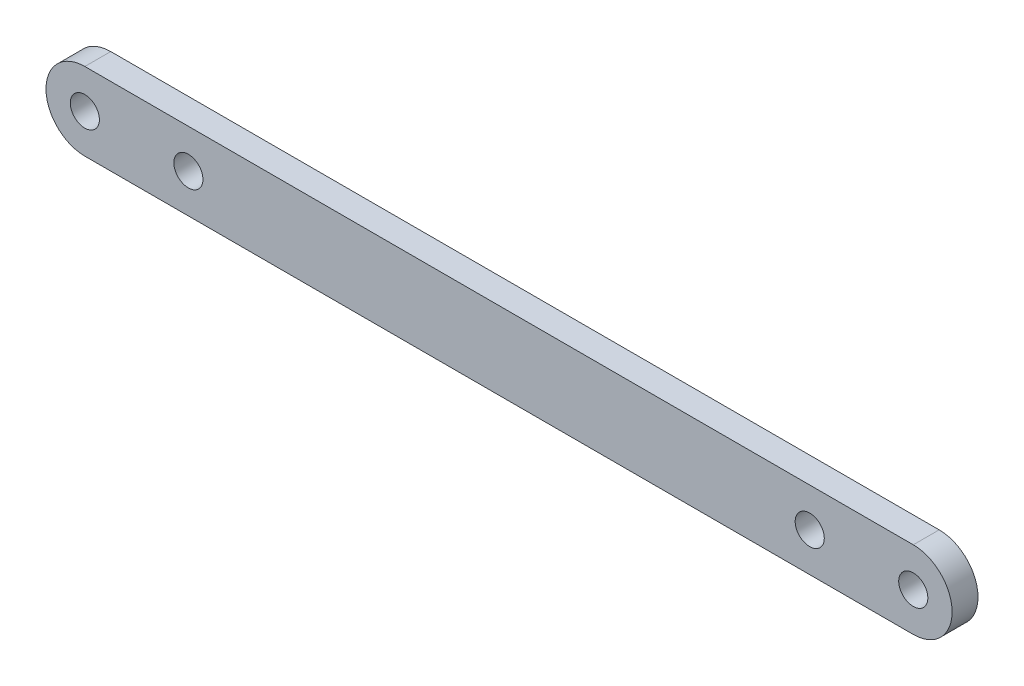
from build123d import *

# Parameters (mm, degrees)
BOSS_EXTRUDE1_DEPTH             = 3.175
F_9_64_0_14063_DIAMETER_HOLE1_D = 3.572002
F_9_64_0_14063_DIAMETER_HOLE2_D = 3.572002


with BuildPart() as part:
    # Sketch1 → Boss-Extrude1 (new body)
    with BuildSketch(Plane.XY):
        with BuildLine():
            Line((0, -4.7625), (-101.6, -4.7625))
            ThreePointArc((-101.6, -4.7625), (-106.3625, 0), (-101.6, 4.7625))
            Line((-101.6, 4.7625), (0, 4.7625))
            ThreePointArc((0, 4.7625), (4.7625, 0), (0, -4.7625))
        make_face()
    extrude(amount=BOSS_EXTRUDE1_DEPTH)

    # 9/64 (0.14063) Diameter Hole1 (through all)
    with Locations(Plane.XY.offset(3.175)):
        with Locations((0, 0), (-101.6, 0)):
            Hole(F_9_64_0_14063_DIAMETER_HOLE1_D / 2)

    # 9/64 (0.14063) Diameter Hole2 (through all)
    with Locations(Plane.XY.offset(3.175)):
        with Locations((-12.7, 0), (-88.9, 0)):
            Hole(F_9_64_0_14063_DIAMETER_HOLE2_D / 2)


solid = part.part
